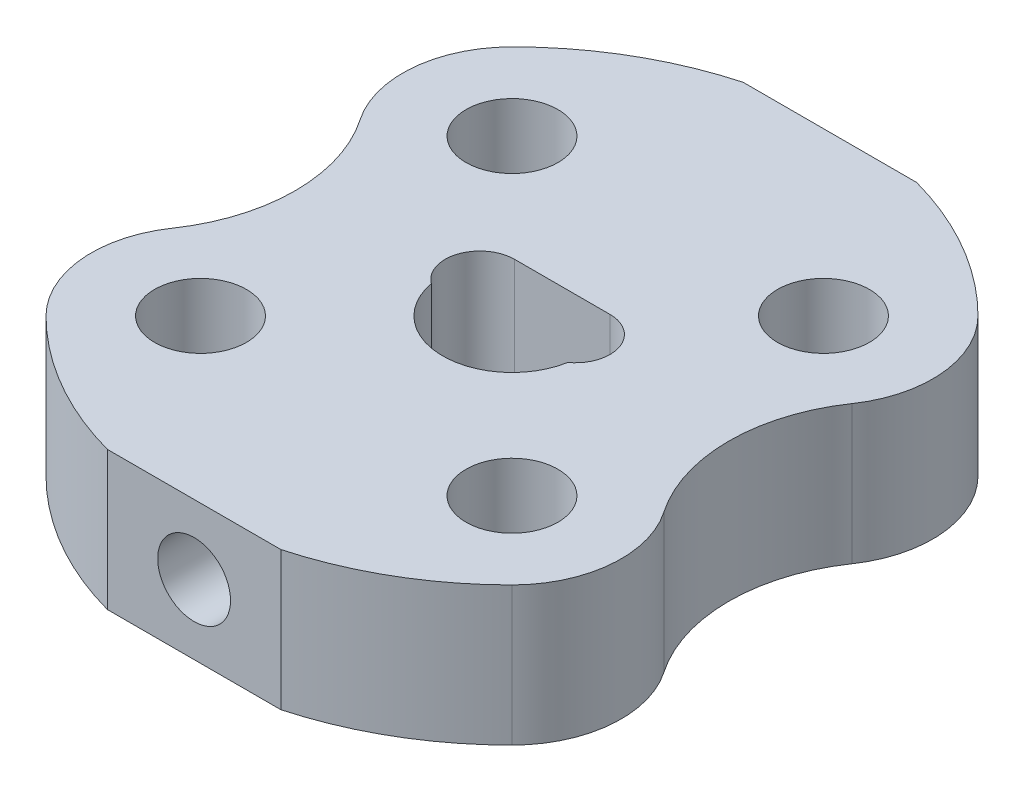
from build123d import *

# Parameters (mm, degrees)
SKETCH1_R                 = 1.325
BASE_SHAPE_DEPTH          = 4
M2_5_GRUB_SCREW_CUT_REACH = 22.258
SKETCH3_R                 = 1.05


with BuildPart() as part:
    # Sketch1 → Base shape (new body)
    with BuildSketch(Plane(origin=(0, 0, 0), x_dir=(1, 0, 0), z_dir=(0, 1, 0))):
        with BuildLine():
            ThreePointArc((-6.717514408, -6.717514435), (-4.768477182, -8.21654583), (-2.5, -9.16515139))
            Line((-2.5, -9.16515139), (2.5, -9.16515139))
            ThreePointArc((2.5, -9.16515139), (4.768477187, -8.216545827), (6.717514416, -6.717514426))
            ThreePointArc((6.717514416, -6.717514426), (7.626672757, -4.780967132), (7.089089998, -2.710269402))
            ThreePointArc((7.089089998, -2.710269402), (6.25, 0), (7.089089998, 2.710269402))
            ThreePointArc((7.089089998, 2.710269402), (7.626672757, 4.780967133), (6.717514415, 6.717514428))
            ThreePointArc((6.717514415, 6.717514428), (4.768477186, 8.216545827), (2.5, 9.16515139))
            Line((2.5, 9.16515139), (-2.5, 9.16515139))
            ThreePointArc((-2.5, 9.16515139), (-4.768477177, 8.216545832), (-6.7175144, 6.717514442))
            ThreePointArc((-6.7175144, 6.717514442), (-7.626672756, 4.780967143), (-7.089089998, 2.710269402))
            ThreePointArc((-7.089089998, 2.710269402), (-6.25, 0), (-7.089089998, -2.710269402))
            ThreePointArc((-7.089089998, -2.710269402), (-7.626672757, -4.780967138), (-6.717514408, -6.717514435))
        make_face()
        with BuildLine():
            Line((-1.377497731, 1.45), (1.377497731, 1.45))
            ThreePointArc((1.377497731, 1.45), (2.328061474, 0.760529502), (1.967853902, -0.357142857))
            ThreePointArc((1.967853902, -0.357142857), (0, -2), (-1.967853902, -0.357142857))
            ThreePointArc((-1.967853902, -0.357142857), (-2.328061474, 0.760529502), (-1.377497731, 1.45))
        make_face(mode=Mode.SUBTRACT)
        with Locations((-4.490128061, -4.490128061)):
            Circle(SKETCH1_R, mode=Mode.SUBTRACT)
        with Locations((-4.490128061, 4.490128061)):
            Circle(SKETCH1_R, mode=Mode.SUBTRACT)
        with Locations((4.490128061, 4.490128061)):
            Circle(SKETCH1_R, mode=Mode.SUBTRACT)
        with Locations((4.490128061, -4.490128061)):
            Circle(SKETCH1_R, mode=Mode.SUBTRACT)
    extrude(amount=BASE_SHAPE_DEPTH)

    # Sketch3 → M2.5 Grub screw cut (cut, up to next)
    with BuildSketch(Plane.XY.offset(9.16515139), mode=Mode.PRIVATE) as m2_5_grub_screw_cut_sk1:
        with Locations((0, 2)):
            Circle(SKETCH3_R)
    m2_5_grub_screw_cut_tool1 = extrude(m2_5_grub_screw_cut_sk1.sketch, amount=-M2_5_GRUB_SCREW_CUT_REACH, mode=Mode.PRIVATE) & part.part
    add(m2_5_grub_screw_cut_tool1.solids().sort_by_distance((0, 2, 9.165151))[0], mode=Mode.SUBTRACT)


solid = part.part
